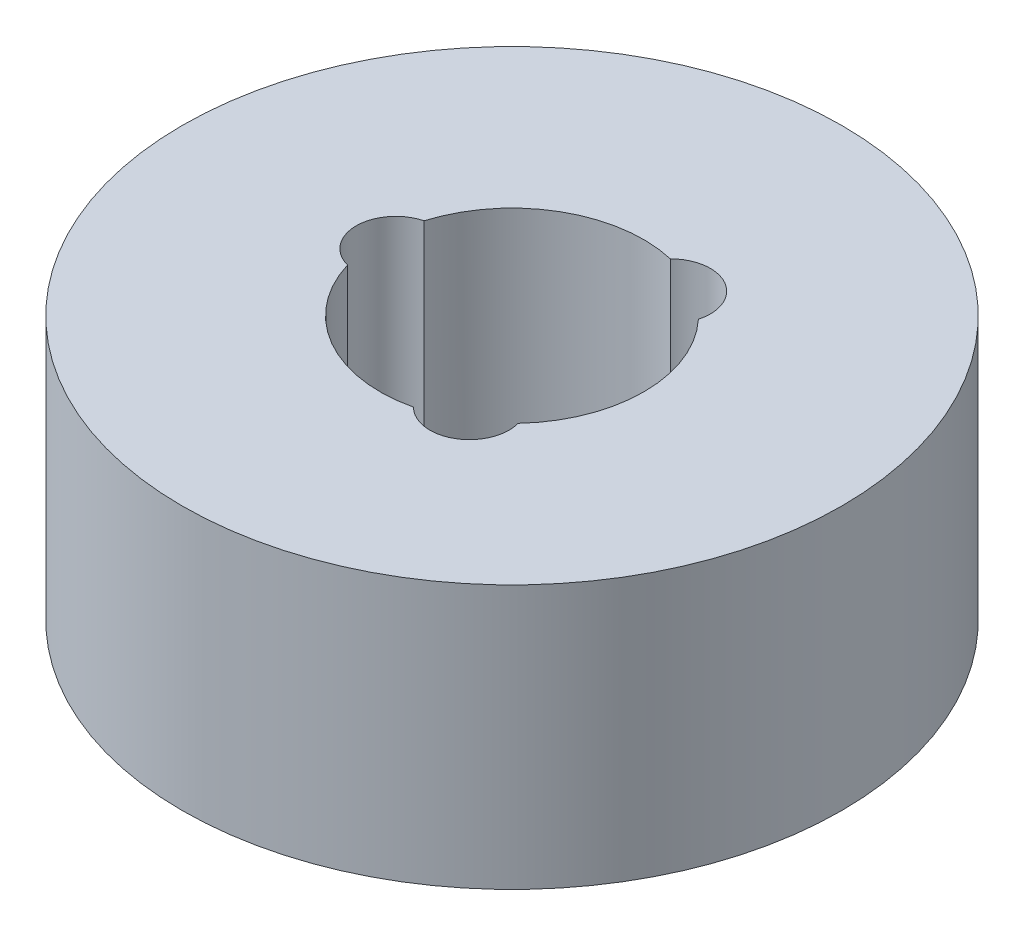
from build123d import *

# Parameters (mm, degrees)
SKETCH1_R           = 12.5
BOSS_EXTRUDE1_DEPTH = 10
SKETCH2_R           = 5
CUT_EXTRUDE1_DEPTH  = 21.310096012
SKETCH3_R           = 1.5
CUT_EXTRUDE2_DEPTH  = 8.555417001
CIRPATTERN1_COUNT   = 3


with BuildPart() as part:
    # Sketch1 → Boss-Extrude1 (new body)
    with BuildSketch(Plane(origin=(0, 0, 0), x_dir=(1, 0, 0), z_dir=(0, 1, 0))):
        Circle(SKETCH1_R)
    extrude(amount=BOSS_EXTRUDE1_DEPTH)

    # Sketch2 → Cut-Extrude1 (cut, through all)
    with BuildSketch(Plane(origin=(0, 0, 0), x_dir=(1, 0, 0), z_dir=(0, 1, 0))):
        Circle(SKETCH2_R)
    extrude(amount=CUT_EXTRUDE1_DEPTH, mode=Mode.SUBTRACT)

    # Sketch3 → Cut-Extrude2 (cut)
    with BuildSketch(Plane(origin=(0, 10, 0), x_dir=(1, 0, 0), z_dir=(0, 1, 0))):
        with Locations((-4.406158325, 0)):
            Circle(SKETCH3_R)
    cut_extrude2 = extrude(amount=-CUT_EXTRUDE2_DEPTH, mode=Mode.SUBTRACT)

    # CirPattern1: Cut-Extrude2 ×3 about axis
    cirpattern1_axis = Axis((0, 0, 0), (0, 1, 0))
    for i in range(1, CIRPATTERN1_COUNT):
        add(cut_extrude2.rotate(cirpattern1_axis, i * 360 / CIRPATTERN1_COUNT), mode=Mode.SUBTRACT)


solid = part.part
